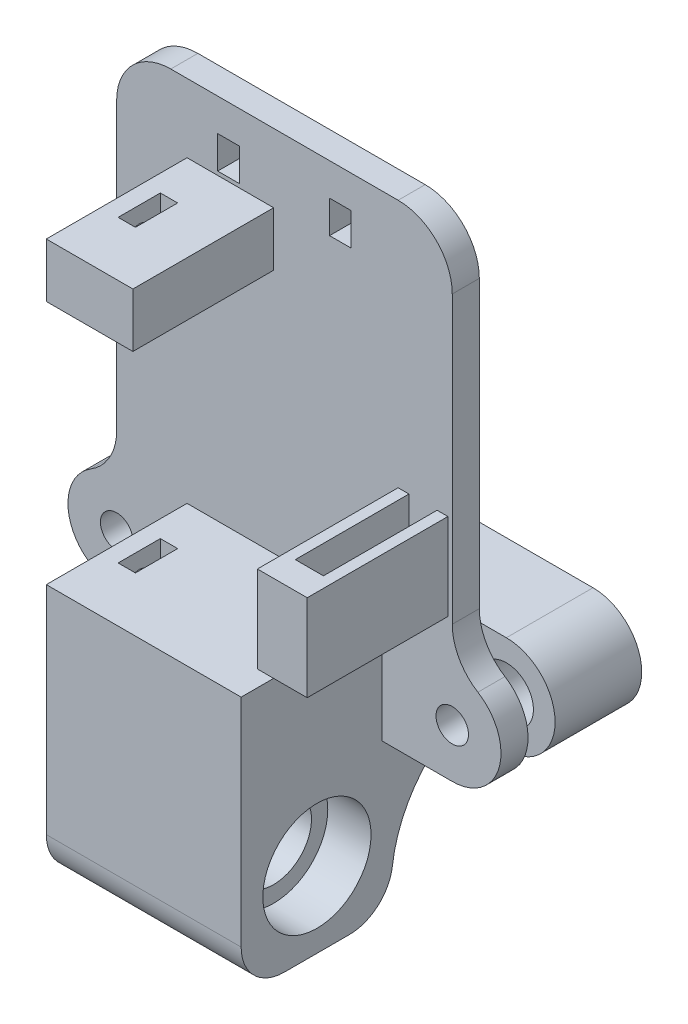
from build123d import *

# Parameters (mm, degrees)
CROQUIS1_R              = 2.5
SALIENTE_EXTRUIR1_DEPTH = 28
SALIENTE_EXTRUIR3_DEPTH = 2.5
CROQUIS8_R              = 1.5
SALIENTE_EXTRUIR4_DEPTH = 2.5
CROQUIS9_W              = 18
CROQUIS9_H              = 10
SALIENTE_EXTRUIR5_DEPTH = 13
CROQUIS3_W              = 18
CROQUIS3_H              = 14
SALIENTE_EXTRUIR2_DEPTH = 14
CROQUIS4_R              = 5
CORTAR_EXTRUIR1_DEPTH   = 4
CORTAR_EXTRUIR2_START   = -14
CROQUIS4_2_R            = 5
CORTAR_EXTRUIR2_DEPTH   = 4
CORTAR_EXTRUIR3_REACH   = 67.584
CROQUIS5_R              = 3.5
REDONDEO1_R             = 4
CROQUIS10_W             = 40
CROQUIS10_H             = 9
CORTAR_EXTRUIR4_DEPTH   = 20
CROQUIS11_W             = 8
CROQUIS11_H             = 5
SALIENTE_EXTRUIR6_DEPTH = 13
CROQUIS12_R             = 1
CORTAR_EXTRUIR5_DEPTH   = 6
CROQUIS13_W             = 1.6
CROQUIS13_H             = 3.9
CORTAR_EXTRUIR6_DEPTH   = 33
REDONDEO2_R             = 5
REDONDEO3_R             = 12
SALIENTE_EXTRUIR7_START = 3
SALIENTE_EXTRUIR7_DEPTH = 8
CROQUIS16_W             = 2
CROQUIS16_H             = 3
CORTAR_EXTRUIR7_DEPTH   = 2.5


with BuildPart() as part:
    # Croquis1 → Saliente-Extruir1 (new body)
    with BuildSketch(Plane.XY):
        with BuildLine():
            Line((-15.5, 4.5), (15.5, 4.5))
            ThreePointArc((15.5, 4.5), (20, 0), (15.5, -4.5))
            Line((15.5, -4.5), (-15.5, -4.5))
            ThreePointArc((-15.5, -4.5), (-20, 0), (-15.5, 4.5))
        make_face()
        with Locations((-15.5, 0)):
            Circle(CROQUIS1_R, mode=Mode.SUBTRACT)
        with Locations(Location((15.5, 0, 0), (0, 0, 180))):
            Circle(CROQUIS1_R, mode=Mode.SUBTRACT)
    extrude(amount=SALIENTE_EXTRUIR1_DEPTH)

    # Croquis7 → Saliente-Extruir3 (add)
    with BuildSketch(Plane.XY.offset(28)):
        with BuildLine():
            Line((10.434561388, -1.264633608), (10.434561388, -4.5))
            Line((10.434561388, -4.5), (-11.065438612, -4.5))
            Line((-11.065438612, -4.5), (-11.065438612, -1.264634516))
            add(Edge.make_bspline(
                [(-11.065438612, -1.264634516), (-10.873261798, -0.150088047), (-9.571810624, 1.50000001), (-7.999999983, 1.5)],
                knots=[0, 0, 0, 0, 1, 1, 1, 1], degree=3))
            Line((-7.999999983, 1.5), (1e-08, 1.5))
            Line((1e-08, 1.5), (7.369122804, 1.500000949))
            add(Edge.make_bspline(
                [(7.369122804, 1.500000949), (8.940933445, 1.500000937), (10.242384596, -0.150087137), (10.434561388, -1.264633608)],
                knots=[0, 0, 0, 0, 1, 1, 1, 1], degree=3))
        make_face()
    extrude(amount=SALIENTE_EXTRUIR3_DEPTH)

    # Croquis8 → Saliente-Extruir4 (add)
    with BuildSketch(Plane.XY.offset(30.5)):
        with BuildLine():
            Line((15.5, 4.5), (15.5, 39.5))
            Line((15.5, 39.5), (-15.5, 39.5))
            Line((-15.5, 39.5), (-15.5, 4.5))
            ThreePointArc((-15.5, 4.5), (-20, 0), (-15.5, -4.5))
            Line((-15.5, -4.5), (15.5, -4.5))
            ThreePointArc((15.5, -4.5), (20, 0), (15.5, 4.5))
        make_face()
        with Locations((15.5, 0)):
            Circle(CROQUIS8_R, mode=Mode.SUBTRACT)
        with Locations((-15.5, 0)):
            Circle(CROQUIS8_R, mode=Mode.SUBTRACT)
    extrude(amount=SALIENTE_EXTRUIR4_DEPTH)

    # Croquis9 → Saliente-Extruir5 (add)
    with BuildSketch(Plane.XY.offset(33)):
        with Locations((0, 0.5)):
            Rectangle(CROQUIS9_W, CROQUIS9_H)
    extrude(amount=SALIENTE_EXTRUIR5_DEPTH)

    # Croquis3 → Saliente-Extruir2 (add)
    with BuildSketch(Plane.XZ.offset(4.5)):
        with Locations((0, 39)):
            Rectangle(CROQUIS3_W, CROQUIS3_H)
    extrude(amount=SALIENTE_EXTRUIR2_DEPTH)

    # Croquis4 → Cortar-Extruir1 (cut)
    with BuildSketch(Plane.ZY.offset(9)):
        with Locations((39, -11.5)):
            Circle(CROQUIS4_R)
    extrude(amount=-CORTAR_EXTRUIR1_DEPTH, mode=Mode.SUBTRACT)

    # Croquis4<2> → Cortar-Extruir2 (cut)
    with BuildSketch(Plane.ZY.offset(9).offset(CORTAR_EXTRUIR2_START)):
        with Locations((39, -11.5)):
            Circle(CROQUIS4_2_R)
    extrude(amount=-CORTAR_EXTRUIR2_DEPTH, mode=Mode.SUBTRACT)

    # Croquis5 → Cortar-Extruir3 (cut, up to next)
    with BuildSketch(Plane.ZY.offset(5), mode=Mode.PRIVATE) as cortar_extruir3_sk1:
        with Locations((39, -11.5)):
            Circle(CROQUIS5_R)
    cortar_extruir3_tool1 = extrude(cortar_extruir3_sk1.sketch, amount=-CORTAR_EXTRUIR3_REACH, mode=Mode.PRIVATE) & part.part
    add(cortar_extruir3_tool1.solids().sort_by_distance((-5, -11.5, 39))[0], mode=Mode.SUBTRACT)

    # Redondeo1
    redondeo1_edges = [part.edges().sort_by_distance(p)[0] for p in [
        (0, -18.5, 32),
        (0, -18.5, 46),
    ]]
    fillet(redondeo1_edges, radius=REDONDEO1_R)

    # Croquis10 → Cortar-Extruir4 (cut)
    with BuildSketch(Plane(origin=(0, 0, 0), x_dir=(-1, 0, 0), z_dir=(0, 0, -1))):
        Rectangle(CROQUIS10_W, CROQUIS10_H)
    extrude(amount=-CORTAR_EXTRUIR4_DEPTH, mode=Mode.SUBTRACT)

    # Croquis11 → Saliente-Extruir6 (add)
    with BuildSketch(Plane.XY.offset(33)):
        with Locations((-5, 30.65)):
            Rectangle(CROQUIS11_W, CROQUIS11_H)
    extrude(amount=SALIENTE_EXTRUIR6_DEPTH)

    # Croquis12 → Cortar-Extruir5 (cut)
    with BuildSketch(Plane.ZY.offset(9)):
        with Locations(Location((39, 3, 0), (0, 0, 270))):
            Circle(CROQUIS12_R)
        with Locations(Location((39, 30.65, 0), (0, 0, 90))):
            Circle(CROQUIS12_R)
    extrude(amount=-CORTAR_EXTRUIR5_DEPTH, mode=Mode.SUBTRACT)

    # Croquis13 → Cortar-Extruir6 (cut)
    with BuildSketch(Plane(origin=(0, 33.15, 0), x_dir=(1, 0, 0), z_dir=(0, 1, 0))):
        with Locations((-6.614967389, -39)):
            Rectangle(CROQUIS13_W, CROQUIS13_H)
    extrude(amount=-CORTAR_EXTRUIR6_DEPTH, mode=Mode.SUBTRACT)

    # Redondeo2
    redondeo2_edges = [part.edges().sort_by_distance(p)[0] for p in [
        (-15.5, 39.5, 31.75),
        (-15.5, 4.5, 31.75),
        (15.5, 4.5, 31.75),
        (15.5, 39.5, 31.75),
    ]]
    fillet(redondeo2_edges, radius=REDONDEO2_R)

    # Redondeo3
    # the kernel refuses this fillet: 12 mm, written as the material it adds along each edge
    with BuildSketch(Plane(origin=(9, -4.5, 32), x_dir=(0, 0, -1), z_dir=(-1, 0, 0))) as redondeo3_piece_1:
        with BuildLine():
            CenterArc((11.874507866, 12), REDONDEO3_R, 187.180755781, 82.819244219)
            Line((-0.031373033, 10.5), (-1.221961123, 10.35))
            ThreePointArc((-1.221961123, 10.35), (-1.2, 10), (-1.2, 0))
            Line((-1.2, 0), (0, -1.2))
            Line((0, -1.2), (11.874507866, -1.2))
            Line((11.874507866, -1.2), (11.874507866, 0))
        make_face()
    extrude(amount=18)

    # Croquis14 → Saliente-Extruir7 (add)
    with BuildSketch(Plane(origin=(0, 5.5, 0), x_dir=(1, 0, 0), z_dir=(0, 1, 0)).offset(SALIENTE_EXTRUIR7_START)):
        Polygon((10.5, -33), (10.5, -46.00000144), (15.1, -46.00000144), (15.1, -33), (14.1, -33), (14.1, -43.5), (11.5, -43.5), (11.5, -33), align=None)
    extrude(amount=SALIENTE_EXTRUIR7_DEPTH)

    # Croquis16 → Cortar-Extruir7 (cut)
    with BuildSketch(Plane(origin=(0, 0, 30.5), x_dir=(-1, 0, 0), z_dir=(0, 0, -1))):
        with Locations((-5.165983378, 35)):
            Rectangle(CROQUIS16_W, CROQUIS16_H)
        with Locations((5.165983378, 35)):
            Rectangle(CROQUIS16_W, CROQUIS16_H)
    extrude(amount=-CORTAR_EXTRUIR7_DEPTH, mode=Mode.SUBTRACT)


solid = part.part
